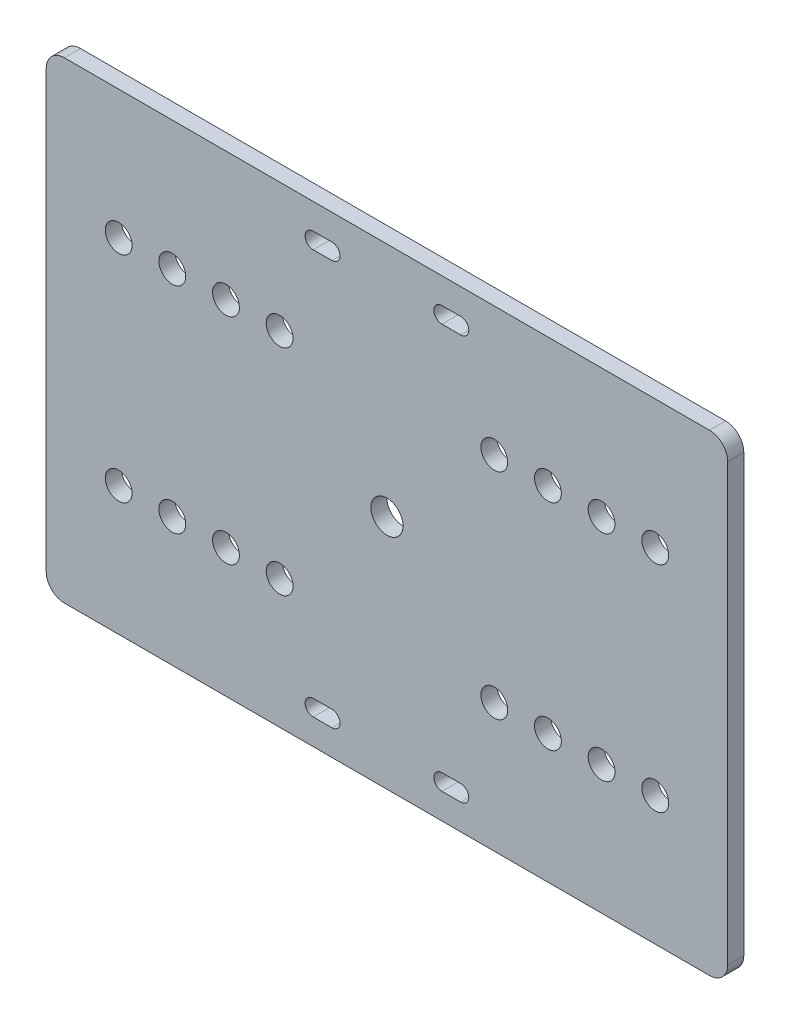
from build123d import *

# Parameters (mm, degrees)
CUT_EXTRUDE1_START       = -3
CUT_EXTRUDE1_OUTLINE_R   = 2.5
CUT_EXTRUDE1_OUTLINE_R_2 = 3.6
CUT_EXTRUDE1_OUTLINE_R_3 = 3
CUT_EXTRUDE1_DEPTH       = 3
SKETCH2_R                = 3.6
SKETCH2_R_2              = 3.600483305
SKETCH2_R_3              = 2.5
BOSS_EXTRUDE2_DEPTH      = 3
BOSS_EXTRUDE3_DEPTH      = 3
CUT_EXTRUDE2_REACH       = 79.313
BOSS_EXTRUDE4_DEPTH      = 3
BOSS_EXTRUDE5_DEPTH      = 3


with BuildPart() as part:
    # Cut-Extrude1: read off the stored shape, not the designer's step
    # Cut-Extrude1 outline → Cut-Extrude1 (new body)
    with BuildSketch(Plane.XY.offset(3).offset(CUT_EXTRUDE1_START)):
        with BuildLine():
            ThreePointArc((-60.12, 44), (-62.51002092, 43.01002092), (-63.5, 40.62))
            Line((-63.5, 40.62), (-63.5, -40.62))
            ThreePointArc((-63.5, -40.62), (-62.51002092, -43.01002092), (-60.12, -44))
            Line((-60.12, -44), (60.12, -44))
            ThreePointArc((60.12, -44), (62.51002092, -43.01002092), (63.5, -40.62))
            Line((63.5, -40.62), (63.5, 40.62))
            ThreePointArc((63.5, 40.62), (62.51002092, 43.01002092), (60.12, 44))
            Line((60.12, 44), (-60.12, 44))
        make_face()
        with Locations((-50, -30)):
            Circle(CUT_EXTRUDE1_OUTLINE_R, mode=Mode.SUBTRACT)
        with Locations((-40, -30)):
            Circle(CUT_EXTRUDE1_OUTLINE_R, mode=Mode.SUBTRACT)
        with BuildLine():
            ThreePointArc((-16.9, -36.2), (-15.4, -37.7), (-16.9, -39.2))
            Line((-16.9, -39.2), (-23.4, -39.2))
            ThreePointArc((-23.4, -39.2), (-24.9, -37.7), (-23.4, -36.2))
            Line((-23.4, -36.2), (-16.9, -36.2))
        make_face(mode=Mode.SUBTRACT)
        with Locations((-30, -30)):
            Circle(CUT_EXTRUDE1_OUTLINE_R, mode=Mode.SUBTRACT)
        with Locations((-20, -30)):
            Circle(CUT_EXTRUDE1_OUTLINE_R, mode=Mode.SUBTRACT)
        with Locations((-50, -20)):
            Circle(CUT_EXTRUDE1_OUTLINE_R, mode=Mode.SUBTRACT)
        with Locations((-40, -20)):
            Circle(CUT_EXTRUDE1_OUTLINE_R, mode=Mode.SUBTRACT)
        with Locations((-30, -20)):
            Circle(CUT_EXTRUDE1_OUTLINE_R, mode=Mode.SUBTRACT)
        with Locations((-20, -20)):
            Circle(CUT_EXTRUDE1_OUTLINE_R, mode=Mode.SUBTRACT)
        with Locations((-10, -20)):
            Circle(CUT_EXTRUDE1_OUTLINE_R, mode=Mode.SUBTRACT)
        with Locations((-14.142135624, -14.142135624)):
            Circle(CUT_EXTRUDE1_OUTLINE_R, mode=Mode.SUBTRACT)
        with Locations((-30, -10)):
            Circle(CUT_EXTRUDE1_OUTLINE_R, mode=Mode.SUBTRACT)
        with Locations((-20, -10)):
            Circle(CUT_EXTRUDE1_OUTLINE_R, mode=Mode.SUBTRACT)
        with BuildLine():
            ThreePointArc((-3.25, -39.2), (-4.75, -37.7), (-3.25, -36.2))
            Line((-3.25, -36.2), (3.25, -36.2))
            ThreePointArc((3.25, -36.2), (4.75, -37.7), (3.25, -39.2))
            Line((3.25, -39.2), (-3.25, -39.2))
        make_face(mode=Mode.SUBTRACT)
        with BuildLine():
            ThreePointArc((23.4, -36.2), (24.9, -37.7), (23.4, -39.2))
            Line((23.4, -39.2), (16.9, -39.2))
            ThreePointArc((16.9, -39.2), (15.4, -37.7), (16.9, -36.2))
            Line((16.9, -36.2), (23.4, -36.2))
        make_face(mode=Mode.SUBTRACT)
        with BuildLine():
            ThreePointArc((10, -27.5), (12.5, -30), (10, -32.5))
            Line((10, -32.5), (-10, -32.5))
            ThreePointArc((-10, -32.5), (-12.5, -30), (-10, -27.5))
            Line((-10, -27.5), (10, -27.5))
        make_face(mode=Mode.SUBTRACT)
        with Locations((20, -30)):
            Circle(CUT_EXTRUDE1_OUTLINE_R_2, mode=Mode.SUBTRACT)
        with Locations((30, -30)):
            Circle(CUT_EXTRUDE1_OUTLINE_R_2, mode=Mode.SUBTRACT)
        with Locations((40, -30)):
            Circle(CUT_EXTRUDE1_OUTLINE_R_2, mode=Mode.SUBTRACT)
        with Locations((50, -30)):
            Circle(CUT_EXTRUDE1_OUTLINE_R_2, mode=Mode.SUBTRACT)
        with Locations((0, -20)):
            Circle(CUT_EXTRUDE1_OUTLINE_R, mode=Mode.SUBTRACT)
        with Locations((10, -20)):
            Circle(CUT_EXTRUDE1_OUTLINE_R, mode=Mode.SUBTRACT)
        with Locations((14.142135624, -14.142135624)):
            Circle(CUT_EXTRUDE1_OUTLINE_R, mode=Mode.SUBTRACT)
        with Locations((20, -20)):
            Circle(CUT_EXTRUDE1_OUTLINE_R, mode=Mode.SUBTRACT)
        with Locations((30, -20)):
            Circle(CUT_EXTRUDE1_OUTLINE_R, mode=Mode.SUBTRACT)
        with Locations((0, -10)):
            Circle(CUT_EXTRUDE1_OUTLINE_R, mode=Mode.SUBTRACT)
        with Locations((20, -10)):
            Circle(CUT_EXTRUDE1_OUTLINE_R, mode=Mode.SUBTRACT)
        with Locations((30, -10)):
            Circle(CUT_EXTRUDE1_OUTLINE_R, mode=Mode.SUBTRACT)
        with Locations((40, -20)):
            Circle(CUT_EXTRUDE1_OUTLINE_R, mode=Mode.SUBTRACT)
        with Locations((50, -20)):
            Circle(CUT_EXTRUDE1_OUTLINE_R, mode=Mode.SUBTRACT)
        with Locations((-50, 0)):
            Circle(CUT_EXTRUDE1_OUTLINE_R, mode=Mode.SUBTRACT)
        with Locations((-40, 0)):
            Circle(CUT_EXTRUDE1_OUTLINE_R, mode=Mode.SUBTRACT)
        with Locations((-50, 20)):
            Circle(CUT_EXTRUDE1_OUTLINE_R, mode=Mode.SUBTRACT)
        with Locations((-40, 20)):
            Circle(CUT_EXTRUDE1_OUTLINE_R, mode=Mode.SUBTRACT)
        with Locations((-30, 0)):
            Circle(CUT_EXTRUDE1_OUTLINE_R, mode=Mode.SUBTRACT)
        with Locations((-20, 0)):
            Circle(CUT_EXTRUDE1_OUTLINE_R, mode=Mode.SUBTRACT)
        with Locations((-30, 10)):
            Circle(CUT_EXTRUDE1_OUTLINE_R, mode=Mode.SUBTRACT)
        with Locations((-20, 10)):
            Circle(CUT_EXTRUDE1_OUTLINE_R, mode=Mode.SUBTRACT)
        with Locations((-10, 0)):
            Circle(CUT_EXTRUDE1_OUTLINE_R, mode=Mode.SUBTRACT)
        with Locations((-30, 20)):
            Circle(CUT_EXTRUDE1_OUTLINE_R, mode=Mode.SUBTRACT)
        with Locations((-20, 20)):
            Circle(CUT_EXTRUDE1_OUTLINE_R, mode=Mode.SUBTRACT)
        with Locations((-14.142135624, 14.142135624)):
            Circle(CUT_EXTRUDE1_OUTLINE_R, mode=Mode.SUBTRACT)
        with Locations((-10, 20)):
            Circle(CUT_EXTRUDE1_OUTLINE_R, mode=Mode.SUBTRACT)
        with Locations((-50, 30)):
            Circle(CUT_EXTRUDE1_OUTLINE_R, mode=Mode.SUBTRACT)
        with Locations((-40, 30)):
            Circle(CUT_EXTRUDE1_OUTLINE_R, mode=Mode.SUBTRACT)
        with Locations((-30, 30)):
            Circle(CUT_EXTRUDE1_OUTLINE_R, mode=Mode.SUBTRACT)
        with Locations((-20, 30)):
            Circle(CUT_EXTRUDE1_OUTLINE_R, mode=Mode.SUBTRACT)
        with BuildLine():
            ThreePointArc((-23.4, 36.2), (-24.9, 37.7), (-23.4, 39.2))
            Line((-23.4, 39.2), (-16.9, 39.2))
            ThreePointArc((-16.9, 39.2), (-15.4, 37.7), (-16.9, 36.2))
            Line((-16.9, 36.2), (-23.4, 36.2))
        make_face(mode=Mode.SUBTRACT)
        Circle(CUT_EXTRUDE1_OUTLINE_R_3, mode=Mode.SUBTRACT)
        with Locations((10, 0)):
            Circle(CUT_EXTRUDE1_OUTLINE_R, mode=Mode.SUBTRACT)
        with Locations((0, 10)):
            Circle(CUT_EXTRUDE1_OUTLINE_R, mode=Mode.SUBTRACT)
        with Locations((20, 0)):
            Circle(CUT_EXTRUDE1_OUTLINE_R_2, mode=Mode.SUBTRACT)
        with Locations((30, 0)):
            Circle(CUT_EXTRUDE1_OUTLINE_R_2, mode=Mode.SUBTRACT)
        with Locations((20, 10)):
            Circle(CUT_EXTRUDE1_OUTLINE_R, mode=Mode.SUBTRACT)
        with Locations((30, 10)):
            Circle(CUT_EXTRUDE1_OUTLINE_R, mode=Mode.SUBTRACT)
        with Locations((14.142135624, 14.142135624)):
            Circle(CUT_EXTRUDE1_OUTLINE_R, mode=Mode.SUBTRACT)
        with Locations((0, 20)):
            Circle(CUT_EXTRUDE1_OUTLINE_R, mode=Mode.SUBTRACT)
        with Locations((10, 20)):
            Circle(CUT_EXTRUDE1_OUTLINE_R, mode=Mode.SUBTRACT)
        with Locations((20, 20)):
            Circle(CUT_EXTRUDE1_OUTLINE_R, mode=Mode.SUBTRACT)
        with Locations((30, 20)):
            Circle(CUT_EXTRUDE1_OUTLINE_R, mode=Mode.SUBTRACT)
        with Locations((40, 0)):
            Circle(CUT_EXTRUDE1_OUTLINE_R_2, mode=Mode.SUBTRACT)
        with Locations((50, 0)):
            Circle(CUT_EXTRUDE1_OUTLINE_R_2, mode=Mode.SUBTRACT)
        with Locations((40, 20)):
            Circle(CUT_EXTRUDE1_OUTLINE_R, mode=Mode.SUBTRACT)
        with Locations((50, 20)):
            Circle(CUT_EXTRUDE1_OUTLINE_R, mode=Mode.SUBTRACT)
        with BuildLine():
            ThreePointArc((10, 32.5), (12.5, 30), (10, 27.5))
            Line((10, 27.5), (-10, 27.5))
            ThreePointArc((-10, 27.5), (-12.5, 30), (-10, 32.5))
            Line((-10, 32.5), (10, 32.5))
        make_face(mode=Mode.SUBTRACT)
        with Locations((20, 30)):
            Circle(CUT_EXTRUDE1_OUTLINE_R_2, mode=Mode.SUBTRACT)
        with Locations((30, 30)):
            Circle(CUT_EXTRUDE1_OUTLINE_R_2, mode=Mode.SUBTRACT)
        with BuildLine():
            ThreePointArc((-3.25, 36.2), (-4.75, 37.7), (-3.25, 39.2))
            Line((-3.25, 39.2), (3.25, 39.2))
            ThreePointArc((3.25, 39.2), (4.75, 37.7), (3.25, 36.2))
            Line((3.25, 36.2), (-3.25, 36.2))
        make_face(mode=Mode.SUBTRACT)
        with BuildLine():
            ThreePointArc((16.9, 36.2), (15.4, 37.7), (16.9, 39.2))
            Line((16.9, 39.2), (23.4, 39.2))
            ThreePointArc((23.4, 39.2), (24.9, 37.7), (23.4, 36.2))
            Line((23.4, 36.2), (16.9, 36.2))
        make_face(mode=Mode.SUBTRACT)
        with Locations((40, 30)):
            Circle(CUT_EXTRUDE1_OUTLINE_R_2, mode=Mode.SUBTRACT)
        with Locations((50, 30)):
            Circle(CUT_EXTRUDE1_OUTLINE_R_2, mode=Mode.SUBTRACT)
    extrude(amount=CUT_EXTRUDE1_DEPTH)

    # Sketch2 → Boss-Extrude2 (add)
    with BuildSketch(Plane(origin=(0, 0, 0), x_dir=(-1, 0, 0), z_dir=(0, 0, -1))):
        with Locations((-40, 30)):
            Circle(SKETCH2_R)
        with Locations((-50, 30)):
            Circle(SKETCH2_R_2)
        with Locations((-30, 30)):
            Circle(SKETCH2_R_2)
        with Locations((-30, -30)):
            Circle(SKETCH2_R)
        with Locations((-50, -30)):
            Circle(SKETCH2_R)
        with Locations((-20, -30)):
            Circle(SKETCH2_R)
        with Locations((-50, 0)):
            Circle(SKETCH2_R)
        with Locations((-30, 0)):
            Circle(SKETCH2_R)
        with Locations((-20, 0)):
            Circle(SKETCH2_R)
        with Locations((-14.142135624, 14.142135624)):
            Circle(SKETCH2_R_3)
        with Locations((-10, 20)):
            Circle(SKETCH2_R_3)
        with Locations((0, 20)):
            Circle(SKETCH2_R_3)
        with Locations((10, 20)):
            Circle(SKETCH2_R_3)
        with Locations((14.142135624, 14.142135624)):
            Circle(SKETCH2_R_3)
        with Locations((0, 10)):
            Circle(SKETCH2_R_3)
        with Locations((-10, 0)):
            Circle(SKETCH2_R_3)
        with Locations((0, -10)):
            Circle(SKETCH2_R_3)
        with Locations((10, 0)):
            Circle(SKETCH2_R_3)
        with Locations((-14.142135624, -14.142135624)):
            Circle(SKETCH2_R_3)
        with Locations((-10, -20)):
            Circle(SKETCH2_R_3)
        with Locations((0, -20)):
            Circle(SKETCH2_R_3)
        with Locations((10, -20)):
            Circle(SKETCH2_R_3)
        with Locations((14.142135624, -14.142135624)):
            Circle(SKETCH2_R_3)
        with Locations((20, 30)):
            Circle(SKETCH2_R_3)
        with Locations((30, 30)):
            Circle(SKETCH2_R_3)
        with Locations((40, 30)):
            Circle(SKETCH2_R_3)
        with Locations((50, 30)):
            Circle(SKETCH2_R_3)
        with Locations((50, -30)):
            Circle(SKETCH2_R_3)
        with Locations((40, -30)):
            Circle(SKETCH2_R_3)
        with Locations((30, -30)):
            Circle(SKETCH2_R_3)
        with Locations((20, -30)):
            Circle(SKETCH2_R_3)
        with Locations((30, 10)):
            Circle(SKETCH2_R_3)
        with Locations((20, 10)):
            Circle(SKETCH2_R_3)
        with Locations((30, -10)):
            Circle(SKETCH2_R_3)
        with Locations((20, -10)):
            Circle(SKETCH2_R_3)
        with Locations((-20, -10)):
            Circle(SKETCH2_R_3)
        with Locations((-30, -10)):
            Circle(SKETCH2_R_3)
        with Locations((-40, -30)):
            Circle(SKETCH2_R)
        with Locations((-20, 30)):
            Circle(SKETCH2_R)
        with Locations((-40, 0)):
            Circle(SKETCH2_R)
        with Locations((-30, 10)):
            Circle(SKETCH2_R_3)
        with Locations((-20, 10)):
            Circle(SKETCH2_R_3)
        with Locations((40, 0)):
            Circle(SKETCH2_R_3)
        with Locations((50, 0)):
            Circle(SKETCH2_R_3)
        with Locations((30, 0)):
            Circle(SKETCH2_R_3)
        with Locations((20, 0)):
            Circle(SKETCH2_R_3)
    extrude(amount=-BOSS_EXTRUDE2_DEPTH)

    # Sketch3 → Boss-Extrude3 (add)
    with BuildSketch(Plane(origin=(0, 0, 0), x_dir=(-1, 0, 0), z_dir=(0, 0, -1))):
        with BuildLine():
            Line((3.25, 39.2), (-3.25, 39.2))
            ThreePointArc((-3.25, 39.2), (-4.75, 37.7), (-3.25, 36.2))
            Line((-3.25, 36.2), (3.25, 36.2))
            ThreePointArc((3.25, 36.2), (4.75, 37.7), (3.25, 39.2))
        make_face()
        with BuildLine():
            Line((3.25, -36.2), (-3.25, -36.2))
            ThreePointArc((-3.25, -36.2), (-4.75, -37.7), (-3.25, -39.2))
            Line((-3.25, -39.2), (3.25, -39.2))
            ThreePointArc((3.25, -39.2), (4.75, -37.7), (3.25, -36.2))
        make_face()
    extrude(amount=-BOSS_EXTRUDE3_DEPTH)

    # Sketch4 → Cut-Extrude2 (cut, up to next)
    with BuildSketch(Plane(origin=(0, 0, 0), x_dir=(-1, 0, 0), z_dir=(0, 0, -1)), mode=Mode.PRIVATE) as cut_extrude2_sk1:
        with BuildLine():
            Line((-10.25, -36.2), (-13.75, -36.2))
            ThreePointArc((-13.75, -36.2), (-15.25, -37.7), (-13.75, -39.2))
            Line((-13.75, -39.2), (-10.25, -39.2))
            ThreePointArc((-10.25, -39.2), (-8.75, -37.7), (-10.25, -36.2))
        make_face()
    cut_extrude2_tool1 = extrude(cut_extrude2_sk1.sketch, amount=-CUT_EXTRUDE2_REACH, mode=Mode.PRIVATE) & part.part
    # Sketch4 → Cut-Extrude2 (cut, up to next)
    with BuildSketch(Plane(origin=(0, 0, 0), x_dir=(-1, 0, 0), z_dir=(0, 0, -1)), mode=Mode.PRIVATE) as cut_extrude2_sk2:
        with BuildLine():
            Line((-13.75, 39.2), (-10.25, 39.2))
            ThreePointArc((-10.25, 39.2), (-8.75, 37.7), (-10.25, 36.2))
            Line((-10.25, 36.2), (-13.75, 36.2))
            ThreePointArc((-13.75, 36.2), (-15.25, 37.7), (-13.75, 39.2))
        make_face()
    cut_extrude2_tool2 = extrude(cut_extrude2_sk2.sketch, amount=-CUT_EXTRUDE2_REACH, mode=Mode.PRIVATE) & part.part
    # Sketch4 → Cut-Extrude2 (cut, up to next)
    with BuildSketch(Plane(origin=(0, 0, 0), x_dir=(-1, 0, 0), z_dir=(0, 0, -1)), mode=Mode.PRIVATE) as cut_extrude2_sk3:
        with BuildLine():
            Line((10.25, 36.2), (13.75, 36.2))
            ThreePointArc((13.75, 36.2), (15.25, 37.7), (13.75, 39.2))
            Line((13.75, 39.2), (10.25, 39.2))
            ThreePointArc((10.25, 39.2), (8.75, 37.7), (10.25, 36.2))
        make_face()
    cut_extrude2_tool3 = extrude(cut_extrude2_sk3.sketch, amount=-CUT_EXTRUDE2_REACH, mode=Mode.PRIVATE) & part.part
    # Sketch4 → Cut-Extrude2 (cut, up to next)
    with BuildSketch(Plane(origin=(0, 0, 0), x_dir=(-1, 0, 0), z_dir=(0, 0, -1)), mode=Mode.PRIVATE) as cut_extrude2_sk4:
        with BuildLine():
            Line((13.75, -39.2), (10.25, -39.2))
            ThreePointArc((10.25, -39.2), (8.75, -37.7), (10.25, -36.2))
            Line((10.25, -36.2), (13.75, -36.2))
            ThreePointArc((13.75, -36.2), (15.25, -37.7), (13.75, -39.2))
        make_face()
    cut_extrude2_tool4 = extrude(cut_extrude2_sk4.sketch, amount=-CUT_EXTRUDE2_REACH, mode=Mode.PRIVATE) & part.part
    add(cut_extrude2_tool1.solids().sort_by_distance((12, -37.7, 0))[0], mode=Mode.SUBTRACT)
    add(cut_extrude2_tool2.solids().sort_by_distance((12, 37.7, 0))[0], mode=Mode.SUBTRACT)
    add(cut_extrude2_tool3.solids().sort_by_distance((-12, 37.7, 0))[0], mode=Mode.SUBTRACT)
    add(cut_extrude2_tool4.solids().sort_by_distance((-12, -37.7, 0))[0], mode=Mode.SUBTRACT)

    # Sketch5 → Boss-Extrude4 (add)
    with BuildSketch(Plane(origin=(0, 0, 0), x_dir=(-1, 0, 0), z_dir=(0, 0, -1))):
        with BuildLine():
            Line((-16.9, -36.2), (-23.4, -36.2))
            ThreePointArc((-23.4, -36.2), (-24.9, -37.7), (-23.4, -39.2))
            Line((-23.4, -39.2), (-16.9, -39.2))
            ThreePointArc((-16.9, -39.2), (-15.4, -37.7), (-16.9, -36.2))
        make_face()
        with BuildLine():
            Line((-16.9, 39.2), (-23.4, 39.2))
            ThreePointArc((-23.4, 39.2), (-24.9, 37.7), (-23.4, 36.2))
            Line((-23.4, 36.2), (-16.9, 36.2))
            ThreePointArc((-16.9, 36.2), (-15.4, 37.7), (-16.9, 39.2))
        make_face()
        with BuildLine():
            Line((16.9, 36.2), (23.4, 36.2))
            ThreePointArc((23.4, 36.2), (24.9, 37.7), (23.4, 39.2))
            Line((23.4, 39.2), (16.9, 39.2))
            ThreePointArc((16.9, 39.2), (15.4, 37.7), (16.9, 36.2))
        make_face()
        with BuildLine():
            Line((16.9, -39.2), (23.4, -39.2))
            ThreePointArc((23.4, -39.2), (24.9, -37.7), (23.4, -36.2))
            Line((23.4, -36.2), (16.9, -36.2))
            ThreePointArc((16.9, -36.2), (15.4, -37.7), (16.9, -39.2))
        make_face()
    extrude(amount=-BOSS_EXTRUDE4_DEPTH)

    # Sketch6 → Boss-Extrude5 (add)
    with BuildSketch(Plane(origin=(0, 0, 0), x_dir=(-1, 0, 0), z_dir=(0, 0, -1))):
        with BuildLine():
            Line((10, 32.5), (-10, 32.5))
            ThreePointArc((-10, 32.5), (-12.5, 30), (-10, 27.5))
            Line((-10, 27.5), (10, 27.5))
            ThreePointArc((10, 27.5), (12.5, 30), (10, 32.5))
        make_face()
        with BuildLine():
            Line((10, -27.5), (-10, -27.5))
            ThreePointArc((-10, -27.5), (-12.5, -30), (-10, -32.5))
            Line((-10, -32.5), (10, -32.5))
            ThreePointArc((10, -32.5), (12.5, -30), (10, -27.5))
        make_face()
    extrude(amount=-BOSS_EXTRUDE5_DEPTH)


solid = part.part
